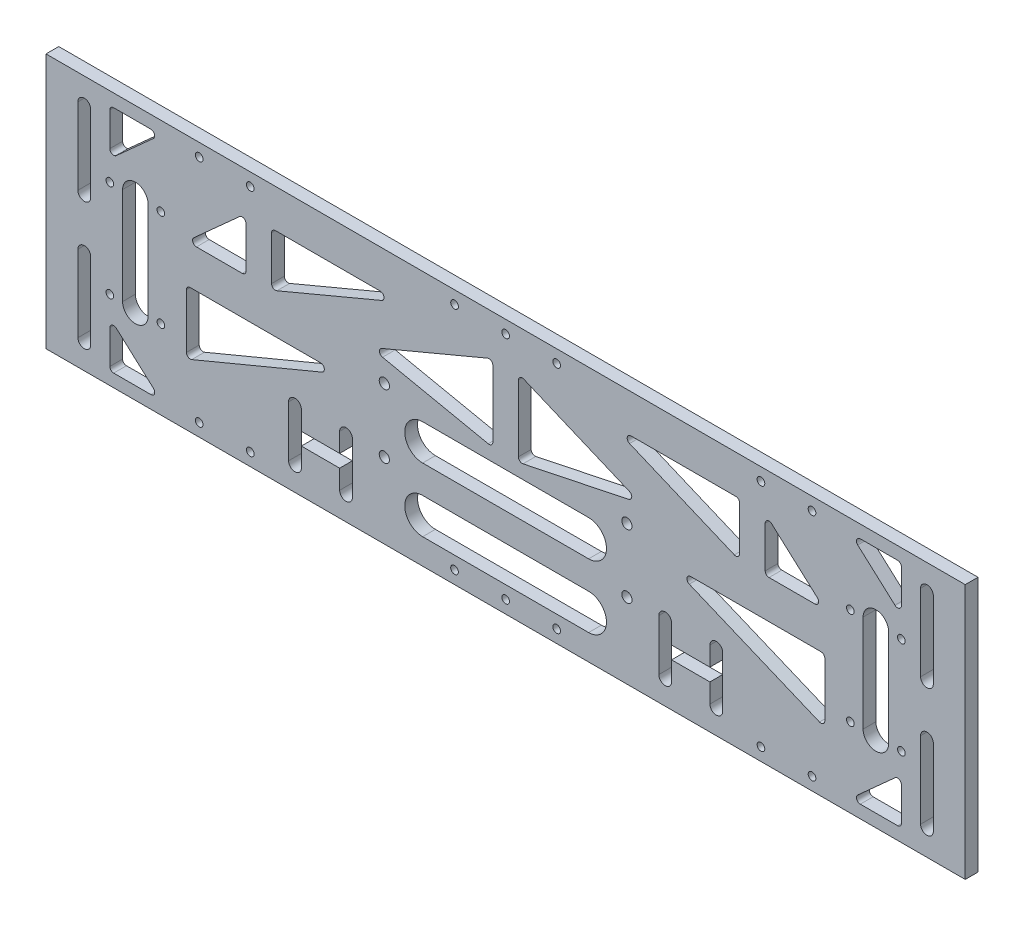
from build123d import *

# Parameters (mm, degrees)
SKETCH_1_W           = 320
SKETCH_1_H           = 121
EXTRUDE_1_DEPTH      = 5
SKETCH_2_W           = 5
SKETCH_2_H           = 30
CUT_EXTRUDE_1_DEPTH  = 343.14909031
SKETCH_3_R           = 1.5
CUT_EXTRUDE_2_DEPTH  = 343.14909031
SKETCH_4_R           = 1.5
CUT_EXTRUDE_3_DEPTH  = 343.14909031
SKETCH_6_R           = 2
CUT_EXTRUDE_5_DEPTH  = 343.14909031
SKETCH_5_W           = 250
SKETCH_5_H           = 30
CUT_EXTRUDE_4_DEPTH  = 343.14909031
SKETCH_7_W           = 260
SKETCH_7_H           = 30
EXTRUDE_2_DEPTH      = 5
SKETCH_8_W           = 320
SKETCH_8_H           = 21
CUT_EXTRUDE_6_DEPTH  = 5
SKETCH_9_W           = 15
SKETCH_9_H           = 100
EXTRUDE_3_DEPTH      = 5
CUT_EXTRUDE_7_DEPTH  = 5
CUT_EXTRUDE_8_DEPTH  = 5
SKETCH_15_R          = 1.5
CUT_EXTRUDE_9_DEPTH  = 357.217630108
CUT_EXTRUDE_10_DEPTH = 357.217630108
CUT_EXTRUDE_11_DEPTH = 357.217630108
SKETCH_18_W          = 5
SKETCH_18_H          = 100
EXTRUDE_4_DEPTH      = 5


with BuildPart() as part:
    # 草图1 → 凸台-拉伸1 (new body)
    with BuildSketch(Plane.XY):
        with Locations((160, 60.5)):
            Rectangle(SKETCH_1_W, SKETCH_1_H)
    extrude(amount=EXTRUDE_1_DEPTH)

    # 草图2 → 切除-拉伸1 (cut, through all)
    with BuildSketch(Plane.XY.offset(5)):
        with Locations((32.5, 15)):
            Rectangle(SKETCH_2_W, SKETCH_2_H)
        with Locations((287.5, 15)):
            Rectangle(SKETCH_2_W, SKETCH_2_H)
    extrude(amount=-CUT_EXTRUDE_1_DEPTH, mode=Mode.SUBTRACT)

    # 草图3 → 切除-拉伸2 (cut, through all)
    with BuildSketch(Plane.XY.offset(5)):
        with Locations((40, 116)):
            Circle(SKETCH_3_R)
        with Locations((60, 116)):
            Circle(SKETCH_3_R)
        with Locations((140, 116)):
            Circle(SKETCH_3_R)
        with Locations((160, 116)):
            Circle(SKETCH_3_R)
        with Locations((260, 116)):
            Circle(SKETCH_3_R)
        with Locations((280, 116)):
            Circle(SKETCH_3_R)
        with Locations((180, 116)):
            Circle(SKETCH_3_R)
    extrude(amount=-CUT_EXTRUDE_2_DEPTH, mode=Mode.SUBTRACT)

    # 草图4 → 切除-拉伸3 (cut, through all)
    with BuildSketch(Plane.XY.offset(5)):
        with Locations((5, 90)):
            Circle(SKETCH_4_R)
        with Locations((25, 90)):
            Circle(SKETCH_4_R)
        with Locations((5, 10)):
            Circle(SKETCH_4_R)
        with Locations((25, 10)):
            Circle(SKETCH_4_R)
        with Locations((295, 10)):
            Circle(SKETCH_4_R)
        with Locations((315, 10)):
            Circle(SKETCH_4_R)
        with Locations((295, 90)):
            Circle(SKETCH_4_R)
        with Locations((315, 90)):
            Circle(SKETCH_4_R)
    extrude(amount=-CUT_EXTRUDE_3_DEPTH, mode=Mode.SUBTRACT)

    # 草图6 → 切除-拉伸5 (cut, through all)
    with BuildSketch(Plane.XY.offset(5)):
        with Locations((112.5, 75.5)):
            Circle(SKETCH_6_R)
        with Locations((207.5, 75.5)):
            Circle(SKETCH_6_R)
        with Locations((207.5, 50.5)):
            Circle(SKETCH_6_R)
        with Locations((112.5, 50.5)):
            Circle(SKETCH_6_R)
        with BuildLine():
            Line((127.5, 70), (192.5, 70))
            ThreePointArc((192.5, 70), (199.5, 63), (192.5, 56))
            Line((192.5, 56), (127.5, 56))
            ThreePointArc((127.5, 56), (120.5, 63), (127.5, 70))
        make_face()
    extrude(amount=-CUT_EXTRUDE_5_DEPTH, mode=Mode.SUBTRACT)

    # 草图5 → 切除-拉伸4 (cut, through all)
    with BuildSketch(Plane.XY.offset(5)):
        with BuildLine():
            Line((5, 101.368043607), (5, 114.5))
            ThreePointArc((5, 114.5), (5.439339828, 115.560660172), (6.5, 116))
            Line((6.5, 116), (21.091062659, 116))
            ThreePointArc((21.091062659, 116), (22.491493276, 115.037395651), (22.094509756, 113.385058781))
            Line((22.094509756, 113.385058781), (7.503447097, 100.253102388))
            ThreePointArc((7.503447097, 100.253102388), (5.889742123, 99.997793512), (5, 101.368043607))
        make_face()
        with BuildLine():
            Line((38.908937341, 85), (56.833333333, 85))
            ThreePointArc((56.833333333, 85), (57.893993505, 85.439339828), (58.333333333, 86.5))
            Line((58.333333333, 86.5), (58.333333333, 102.631956393))
            ThreePointArc((58.333333333, 102.631956393), (57.443591211, 104.002206488), (55.829886236, 103.746897612))
            Line((55.829886236, 103.746897612), (37.905490244, 87.614941219))
            ThreePointArc((37.905490244, 87.614941219), (37.508506724, 85.962604349), (38.908937341, 85))
        make_face()
        with BuildLine():
            Line((35, 68.5), (35, 47.25))
            ThreePointArc((35, 47.25), (35.667949706, 46.001924558), (37.076923077, 45.865384615))
            Line((37.076923077, 45.865384615), (88.076923077, 67.115384615))
            ThreePointArc((88.076923077, 67.115384615), (88.970871014, 68.794174203), (87.5, 70))
            Line((87.5, 70), (36.5, 70))
            ThreePointArc((36.5, 70), (35.439339828, 69.560660172), (35, 68.5))
        make_face()
        with Locations((160, 15)):
            Rectangle(SKETCH_5_W, SKETCH_5_H)
        with BuildLine():
            Line((68.333333333, 87.256929624), (68.333333333, 104.5))
            ThreePointArc((68.333333333, 104.5), (68.772673162, 105.560660172), (69.833333333, 106))
            Line((69.833333333, 106), (110.888262801, 106))
            ThreePointArc((110.888262801, 106), (112.358715068, 104.796260242), (111.469111528, 103.117026842))
            Line((111.469111528, 103.117026842), (70.41418206, 85.873956465))
            ThreePointArc((70.41418206, 85.873956465), (69.00305419, 86.007675228), (68.333333333, 87.256929624))
        make_face()
        with BuildLine():
            Line((111.788920254, 84.01540935), (153.193641955, 75.376872258))
            ThreePointArc((153.193641955, 75.376872258), (154.446166722, 75.68130869), (155, 76.845253935))
            Line((155, 76.845253935), (155, 102.873774141))
            ThreePointArc((155, 102.873774141), (154.330279143, 104.123028536), (152.919151273, 104.256747299))
            Line((152.919151273, 104.256747299), (111.514429572, 86.866764185))
            ThreePointArc((111.514429572, 86.866764185), (110.602180826, 85.340055375), (111.788920254, 84.01540935))
        make_face()
        with BuildLine():
            Line((167.080848727, 104.256747299), (208.485570428, 86.866764185))
            ThreePointArc((208.485570428, 86.866764185), (209.397819174, 85.340055375), (208.211079746, 84.01540935))
            Line((208.211079746, 84.01540935), (166.806358045, 75.376872258))
            ThreePointArc((166.806358045, 75.376872258), (165.553833278, 75.68130869), (165, 76.845253935))
            Line((165, 76.845253935), (165, 102.873774141))
            ThreePointArc((165, 102.873774141), (165.669720857, 104.123028536), (167.080848727, 104.256747299))
        make_face()
        with BuildLine():
            Line((208.530888472, 103.117026842), (249.58581794, 85.873956465))
            ThreePointArc((249.58581794, 85.873956465), (250.99694581, 86.007675228), (251.666666667, 87.256929624))
            Line((251.666666667, 87.256929624), (251.666666667, 104.5))
            ThreePointArc((251.666666667, 104.5), (251.227326838, 105.560660172), (250.166666667, 106))
            Line((250.166666667, 106), (209.111737199, 106))
            ThreePointArc((209.111737199, 106), (207.641284932, 104.796260242), (208.530888472, 103.117026842))
        make_face()
        with BuildLine():
            Line((232.5, 70), (283.5, 70))
            ThreePointArc((283.5, 70), (284.560660172, 69.560660172), (285, 68.5))
            Line((285, 68.5), (285, 47.25))
            ThreePointArc((285, 47.25), (284.332050294, 46.001924558), (282.923076923, 45.865384615))
            Line((282.923076923, 45.865384615), (231.923076923, 67.115384615))
            ThreePointArc((231.923076923, 67.115384615), (231.029128986, 68.794174203), (232.5, 70))
        make_face()
        with BuildLine():
            Line((264.170113764, 103.746897612), (282.094509756, 87.614941219))
            ThreePointArc((282.094509756, 87.614941219), (282.491493276, 85.962604349), (281.091062659, 85))
            Line((281.091062659, 85), (263.166666667, 85))
            ThreePointArc((263.166666667, 85), (262.106006495, 85.439339828), (261.666666667, 86.5))
            Line((261.666666667, 86.5), (261.666666667, 102.631956393))
            ThreePointArc((261.666666667, 102.631956393), (262.556408789, 104.002206488), (264.170113764, 103.746897612))
        make_face()
        with BuildLine():
            Line((297.905490244, 113.385058781), (312.496552903, 100.253102388))
            ThreePointArc((312.496552903, 100.253102388), (314.110257877, 99.997793512), (315, 101.368043607))
            Line((315, 101.368043607), (315, 114.5))
            ThreePointArc((315, 114.5), (314.560660172, 115.560660172), (313.5, 116))
            Line((313.5, 116), (298.908937341, 116))
            ThreePointArc((298.908937341, 116), (297.508506724, 115.037395651), (297.905490244, 113.385058781))
        make_face()
    extrude(amount=-CUT_EXTRUDE_4_DEPTH, mode=Mode.SUBTRACT)

    # 草图7 → 凸台-拉伸2 (add)
    with BuildSketch(Plane(origin=(0, 0, 0), x_dir=(-1, 0, 0), z_dir=(0, 0, -1))):
        with Locations((-160, 15)):
            Rectangle(SKETCH_7_W, SKETCH_7_H)
    extrude(amount=-EXTRUDE_2_DEPTH)

    # 草图8 → 切除-拉伸6 (cut)
    with BuildSketch(Plane(origin=(0, 0, 0), x_dir=(-1, 0, 0), z_dir=(0, 0, -1))):
        with Locations((-160, 10.5)):
            Rectangle(SKETCH_8_W, SKETCH_8_H)
    extrude(amount=-CUT_EXTRUDE_6_DEPTH, mode=Mode.SUBTRACT)

    # 草图9 → 凸台-拉伸3 (add)
    with BuildSketch(Plane(origin=(0, 0, 0), x_dir=(-1, 0, 0), z_dir=(0, 0, -1))):
        with Locations((-327.5, 71)):
            Rectangle(SKETCH_9_W, SKETCH_9_H)
        with Locations((7.5, 71)):
            Rectangle(SKETCH_9_W, SKETCH_9_H)
    extrude(amount=-EXTRUDE_3_DEPTH)

    # 草图10 → 切除-拉伸7 (cut)
    with BuildSketch(Plane(origin=(0, 0, 0), x_dir=(-1, 0, 0), z_dir=(0, 0, -1))):
        with BuildLine():
            ThreePointArc((-327.5, 81), (-325, 78.5), (-322.5, 81))
            Line((-322.5, 81), (-322.5, 111))
            ThreePointArc((-322.5, 111), (-325, 113.5), (-327.5, 111))
            Line((-327.5, 111), (-327.5, 81))
        make_face()
        with BuildLine():
            ThreePointArc((-322.5, 61), (-325, 63.5), (-327.5, 61))
            Line((-327.5, 61), (-327.5, 31))
            ThreePointArc((-327.5, 31), (-325, 28.5), (-322.5, 31))
            Line((-322.5, 31), (-322.5, 61))
        make_face()
        with BuildLine():
            ThreePointArc((2.5, 81), (5, 78.5), (7.5, 81))
            Line((7.5, 81), (7.5, 111))
            ThreePointArc((7.5, 111), (5, 113.5), (2.5, 111))
            Line((2.5, 111), (2.5, 81))
        make_face()
        with BuildLine():
            ThreePointArc((7.5, 61), (5, 63.5), (2.5, 61))
            Line((2.5, 61), (2.5, 31))
            ThreePointArc((2.5, 31), (5, 28.5), (7.5, 31))
            Line((7.5, 31), (7.5, 61))
        make_face()
    extrude(amount=-CUT_EXTRUDE_7_DEPTH, mode=Mode.SUBTRACT)

    # 草图13 → 切除-拉伸8 (cut)
    with BuildSketch(Plane(origin=(0, 0, 0), x_dir=(-1, 0, 0), z_dir=(0, 0, -1))):
        with BuildLine():
            ThreePointArc((-192.5, 45), (-199.5, 38), (-192.5, 31))
            Line((-192.5, 31), (-127.5, 31))
            ThreePointArc((-127.5, 31), (-120.5, 38), (-127.5, 45))
            Line((-127.5, 45), (-192.5, 45))
        make_face()
    extrude(amount=-CUT_EXTRUDE_8_DEPTH, mode=Mode.SUBTRACT)

    # 草图15 → 切除-拉伸9 (cut, through all)
    with BuildSketch(Plane(origin=(0, 0, 0), x_dir=(-1, 0, 0), z_dir=(0, 0, -1))):
        with BuildLine():
            ThreePointArc((-22.094509756, 28.614941219), (-22.491493276, 26.962604349), (-21.091062659, 26))
            Line((-21.091062659, 26), (-6.5, 26))
            ThreePointArc((-6.5, 26), (-5.439339828, 26.439339828), (-5, 27.5))
            Line((-5, 27.5), (-5, 40.631956393))
            ThreePointArc((-5, 40.631956393), (-5.889742123, 42.002206488), (-7.503447097, 41.746897612))
            Line((-7.503447097, 41.746897612), (-22.094509756, 28.614941219))
        make_face()
        with BuildLine():
            Line((-315, 40.631956393), (-315, 27.5))
            ThreePointArc((-315, 27.5), (-314.560660172, 26.439339828), (-313.5, 26))
            Line((-313.5, 26), (-298.908937341, 26))
            ThreePointArc((-298.908937341, 26), (-297.508506724, 26.962604349), (-297.905490244, 28.614941219))
            Line((-297.905490244, 28.614941219), (-312.496552903, 41.746897612))
            ThreePointArc((-312.496552903, 41.746897612), (-314.110257877, 42.002206488), (-315, 40.631956393))
        make_face()
        with Locations((-25, 52)):
            Circle(SKETCH_15_R)
        with Locations((-5, 52)):
            Circle(SKETCH_15_R)
        with Locations((-40, 26)):
            Circle(SKETCH_15_R)
        with Locations((-60, 26)):
            Circle(SKETCH_15_R)
        with Locations((-140, 26)):
            Circle(SKETCH_15_R)
        with Locations((-160, 26)):
            Circle(SKETCH_15_R)
        with Locations((-180, 26)):
            Circle(SKETCH_15_R)
        with Locations((-260, 26)):
            Circle(SKETCH_15_R)
        with Locations((-280, 26)):
            Circle(SKETCH_15_R)
        with Locations((-295, 52)):
            Circle(SKETCH_15_R)
        with Locations((-315, 52)):
            Circle(SKETCH_15_R)
    extrude(amount=-CUT_EXTRUDE_9_DEPTH, mode=Mode.SUBTRACT)

    # 草图16 → 切除-拉伸10 (cut, through all)
    with BuildSketch(Plane(origin=(0, 0, 0), x_dir=(-1, 0, 0), z_dir=(0, 0, -1))):
        with BuildLine():
            Line((-310, 90), (-310, 52))
            ThreePointArc((-310, 52), (-305, 47), (-300, 52))
            Line((-300, 52), (-300, 90))
            ThreePointArc((-300, 90), (-305, 95), (-310, 90))
        make_face()
        with BuildLine():
            Line((-20, 90), (-20, 52))
            ThreePointArc((-20, 52), (-15, 47), (-10, 52))
            Line((-10, 52), (-10, 90))
            ThreePointArc((-10, 90), (-15, 95), (-20, 90))
        make_face()
    extrude(amount=-CUT_EXTRUDE_10_DEPTH, mode=Mode.SUBTRACT)

    # 草图17 → 切除-拉伸11 (cut, through all)
    with BuildSketch(Plane(origin=(0, 0, 0), x_dir=(-1, 0, 0), z_dir=(0, 0, -1))):
        with BuildLine():
            ThreePointArc((-220, 50.5), (-222.5, 53), (-225, 50.5))
            Line((-225, 50.5), (-225, 43))
            Line((-225, 43), (-240, 43))
            Line((-240, 43), (-240, 50.5))
            ThreePointArc((-240, 50.5), (-242.5, 53), (-245, 50.5))
            Line((-245, 50.5), (-245, 30.5))
            ThreePointArc((-245, 30.5), (-242.5, 28), (-240, 30.5))
            Line((-240, 30.5), (-240, 38))
            Line((-240, 38), (-225, 38))
            Line((-225, 38), (-225, 30.5))
            ThreePointArc((-225, 30.5), (-222.5, 28), (-220, 30.5))
            Line((-220, 30.5), (-220, 50.5))
        make_face()
        with BuildLine():
            ThreePointArc((-95, 50.5), (-97.5, 53), (-100, 50.5))
            Line((-100, 50.5), (-100, 30.5))
            ThreePointArc((-100, 30.5), (-97.5, 28), (-95, 30.5))
            Line((-95, 30.5), (-95, 38))
            Line((-95, 38), (-80, 38))
            Line((-80, 38), (-80, 30.5))
            ThreePointArc((-80, 30.5), (-77.5, 28), (-75, 30.5))
            Line((-75, 30.5), (-75, 50.5))
            ThreePointArc((-75, 50.5), (-77.5, 53), (-80, 50.5))
            Line((-80, 50.5), (-80, 43))
            Line((-80, 43), (-95, 43))
            Line((-95, 43), (-95, 50.5))
        make_face()
    extrude(amount=-CUT_EXTRUDE_11_DEPTH, mode=Mode.SUBTRACT)

    # 草图18 → 凸台-拉伸4 (add)
    with BuildSketch(Plane(origin=(0, 0, 0), x_dir=(-1, 0, 0), z_dir=(0, 0, -1))):
        with Locations((-337.5, 71)):
            Rectangle(SKETCH_18_W, SKETCH_18_H)
        with Locations((17.5, 71)):
            Rectangle(SKETCH_18_W, SKETCH_18_H)
    extrude(amount=-EXTRUDE_4_DEPTH)


solid = part.part
